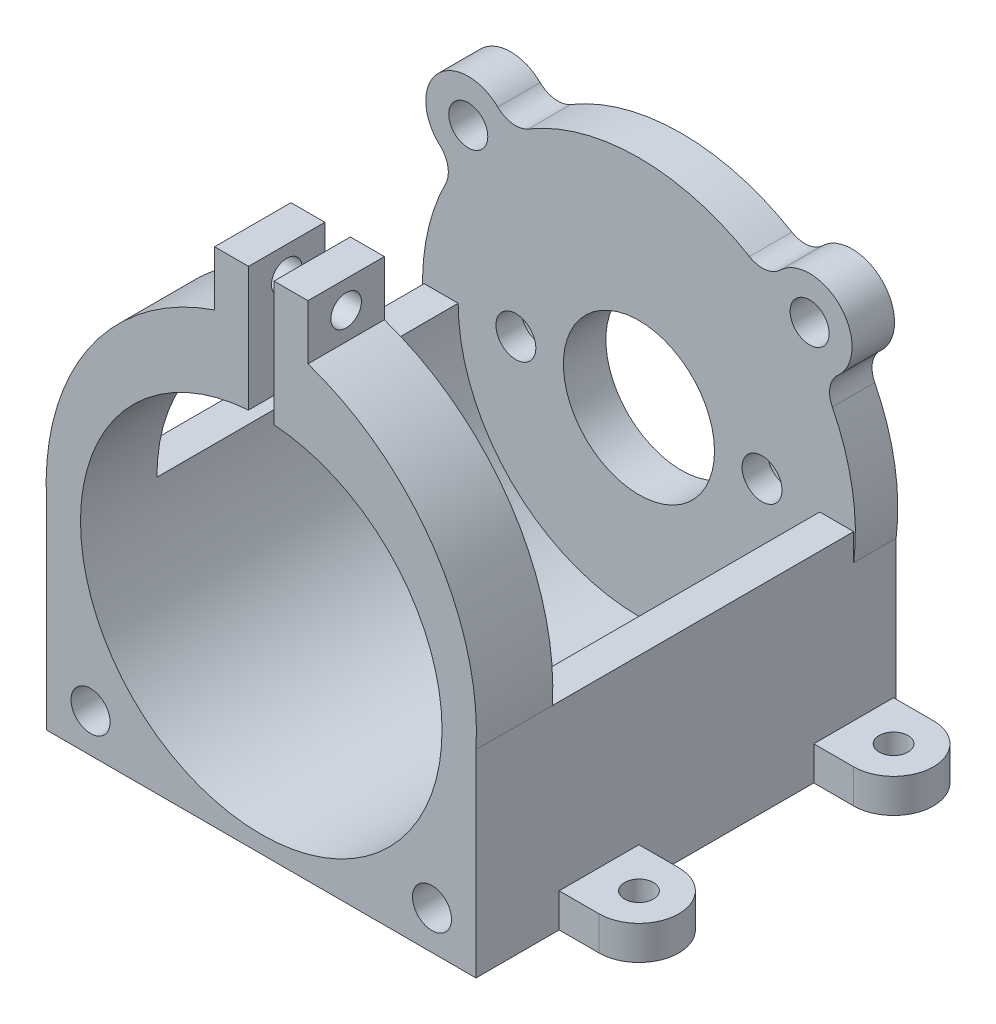
from build123d import *
from build123d.topology import SkipClean

# Parameters (mm, degrees)
SKETCH_1_R               = 2.35
SKETCH_1_R_2             = 8.9
EXTRUDE_1_DEPTH          = 5
EXTRUDE_2_DEPTH          = 44.5
EXTRUDE_2_DEPTH_BACK     = 5
EXTRUDE_START            = -9
EXTRUDE_3_DEPTH          = 9
SKETCH_5_R               = 1.8
CUT_EXTRUDE_2_DEPTH      = 19
CUT_EXTRUDE_5_DEPTH      = 10
CUT_EXTRUDE_5_DEPTH_BACK = 10
SKETCH_9_W               = 118.709111843
SKETCH_9_H               = 68.105929764
SKETCH_9_W_2             = 50.6
SKETCH_9_H_2             = 49.5
SKETCH_10_W              = 50.6
SKETCH_10_H              = 4.95
CUT_EXTRUDE_6_DEPTH      = 67.26064134
SKETCH_11_R              = 2.3
CUT_EXTRUDE_7_DEPTH      = 67.26064134
SKETCH_12_R              = 2.3
CUT_EXTRUDE_8_DEPTH      = 10
SKETCH_13_R              = 4.5
CUT_EXTRUDE_9_DEPTH      = 2
SKETCH_14_R              = 1.7
EXTRUDE_4_DEPTH          = 4


with BuildPart() as part:
    # Эскиз1 → Бобышка-Вытянуть1 (new body)
    with BuildSketch(Plane.XY):
        with BuildLine():
            ThreePointArc((-13.019103812, -21.9260789), (-14.899244328, -21.525926197), (-16.636311976, -22.349119084))
            ThreePointArc((-16.636311976, -22.349119084), (-23.768995303, -22.164946702), (-23.455168213, -15.036791017))
            ThreePointArc((-23.455168213, -15.036791017), (-22.512808868, -13.361377812), (-22.780834847, -11.457903983))
            ThreePointArc((-22.780834847, -11.457903983), (-25.5, 0), (-22.780834847, 11.457903983))
            ThreePointArc((-22.780834847, 11.457903983), (-22.512808868, 13.361377812), (-23.455168213, 15.036791017))
            ThreePointArc((-23.455168213, 15.036791017), (-23.768995303, 22.164946702), (-16.636311976, 22.349119084))
            ThreePointArc((-16.636311976, 22.349119084), (-14.899244328, 21.525926197), (-13.019103812, 21.9260789))
            ThreePointArc((-13.019103812, 21.9260789), (0, 25.5), (13.019103812, 21.9260789))
            ThreePointArc((13.019103812, 21.9260789), (14.899244328, 21.525926197), (16.636311976, 22.349119084))
            ThreePointArc((16.636311976, 22.349119084), (23.768995303, 22.164946702), (23.455168213, 15.036791017))
            ThreePointArc((23.455168213, 15.036791017), (22.512808868, 13.361377812), (22.780834847, 11.457903983))
            ThreePointArc((22.780834847, 11.457903983), (25.5, 0), (22.780834847, -11.457903983))
            ThreePointArc((22.780834847, -11.457903983), (22.512808868, -13.361377812), (23.455168213, -15.036791017))
            ThreePointArc((23.455168213, -15.036791017), (23.768995303, -22.164946702), (16.636311976, -22.349119084))
            ThreePointArc((16.636311976, -22.349119084), (14.899244328, -21.525926197), (13.019103812, -21.9260789))
            ThreePointArc((13.019103812, -21.9260789), (0, -25.5), (-13.019103812, -21.9260789))
        make_face()
        with Locations((-14.5, 0)):
            Circle(SKETCH_1_R, mode=Mode.SUBTRACT)
        with Locations((14.5, 0)):
            Circle(SKETCH_1_R, mode=Mode.SUBTRACT)
        Circle(SKETCH_1_R_2, mode=Mode.SUBTRACT)
    extrude(amount=EXTRUDE_1_DEPTH)

    # Эскиз2 → Бобышка-Вытянуть2 (add, two sides: drawn at the far end of the back side and taken through both)
    with BuildSketch(Plane.XY.offset(5).offset(-EXTRUDE_2_DEPTH_BACK)):
        with BuildLine():
            Line((-25.3, 0), (-21.3, 0))
            ThreePointArc((-21.3, 0), (0, -21.3), (21.3, 0))
            Line((21.3, 0), (25.3, 0))
            Line((25.3, 0), (25.3, -13.25))
            ThreePointArc((25.3, -13.25), (28.228932188, -20.321067812), (35.3, -23.25))
            Line((35.3, -23.25), (50, -23.25))
            Line((50, -23.25), (50, -28.25))
            Line((50, -28.25), (-50, -28.25))
            Line((-50, -28.25), (-50, -23.25))
            Line((-50, -23.25), (-35.3, -23.25))
            ThreePointArc((-35.3, -23.25), (-28.228932188, -20.321067812), (-25.3, -13.25))
            Line((-25.3, -13.25), (-25.3, 0))
        make_face()
    extrude(amount=EXTRUDE_2_DEPTH + EXTRUDE_2_DEPTH_BACK)

    # Эскиз4 → Бобышка-Вытянуть3 (add)
    with SkipClean():  # the faces are left unmerged after this step: merging them gives an invalid solid
        with BuildSketch(Plane.XY.offset(49.5).offset(EXTRUDE_START)):
            with BuildLine():
                Line((21.3, 0), (25.3, 0))
                ThreePointArc((25.3, 0), (20.373090978, 18.07450089), (5.5, 29.465426213))
                Line((5.5, 29.465426213), (5.5, 35.916188423))
                Line((5.5, 35.916188423), (1.5, 35.916188423))
                Line((1.5, 35.916188423), (1.5, 29.916188423))
                Line((1.5, 29.916188423), (1.5, 21.247117452))
                ThreePointArc((1.5, 21.247117452), (15.582682696, 14.521363572), (21.3, 0))
            make_face()
            with BuildLine():
                Line((-25.3, 0), (-21.3, 0))
                ThreePointArc((-21.3, 0), (-15.582682696, 14.521363572), (-1.5, 21.247117452))
                Line((-1.5, 21.247117452), (-1.5, 29.916188423))
                Line((-1.5, 29.916188423), (-1.5, 35.916188423))
                Line((-1.5, 35.916188423), (-5.5, 35.916188423))
                Line((-5.5, 35.916188423), (-5.5, 29.465426213))
                ThreePointArc((-5.5, 29.465426213), (-20.373090978, 18.07450089), (-25.3, 0))
            make_face()
        extrude(amount=EXTRUDE_3_DEPTH)

    # Эскиз5 → Вырез-Вытянуть2 (cut)
    with SkipClean():  # the faces are left unmerged after this step: merging them gives an invalid solid
        with BuildSketch(Plane.ZY.offset(5.5)):
            with Locations((45, 32.690807318)):
                Circle(SKETCH_5_R)
        extrude(amount=-CUT_EXTRUDE_2_DEPTH, mode=Mode.SUBTRACT)

    # Эскиз9 → Вырез-Вытянуть5 (cut, two sides: drawn at the far end of the back side and taken through both)
    with SkipClean():  # the faces are left unmerged after this step: merging them gives an invalid solid
        with BuildSketch(Plane(origin=(0, -23.25, 0), x_dir=(1, 0, 0), z_dir=(0, 1, 0)).offset(-CUT_EXTRUDE_5_DEPTH_BACK)):
            with Locations((-0.535798399, -23.678403203)):
                Rectangle(SKETCH_9_W, SKETCH_9_H)
            with Locations((0, -24.75)):
                Rectangle(SKETCH_9_W_2, SKETCH_9_H_2, mode=Mode.SUBTRACT)
        extrude(amount=CUT_EXTRUDE_5_DEPTH + CUT_EXTRUDE_5_DEPTH_BACK, mode=Mode.SUBTRACT)

    # Эскиз10 → Вырез-Вытянуть6 (cut, through all)
    with SkipClean():  # the faces are left unmerged after this step: merging them gives an invalid solid
        with BuildSketch(Plane.XY.offset(49.5)):
            with Locations((0, -25.775)):
                Rectangle(SKETCH_10_W, SKETCH_10_H)
        extrude(amount=-CUT_EXTRUDE_6_DEPTH, mode=Mode.SUBTRACT)

    # Эскиз11 → Вырез-Вытянуть7 (cut, through all)
    with SkipClean():  # the faces are left unmerged after this step: merging them gives an invalid solid
        with BuildSketch(Plane(origin=(0, 0, 0), x_dir=(-1, 0, 0), z_dir=(0, 0, -1))):
            with Locations((-20.112226795, -18.754954902)):
                Circle(SKETCH_11_R)
            with Locations((20.112226795, -18.754954902)):
                Circle(SKETCH_11_R)
        extrude(amount=-CUT_EXTRUDE_7_DEPTH, mode=Mode.SUBTRACT)

    # Эскиз12 → Вырез-Вытянуть8 (cut)
    with SkipClean():  # the faces are left unmerged after this step: merging them gives an invalid solid
        with BuildSketch(Plane(origin=(0, 0, 0), x_dir=(-1, 0, 0), z_dir=(0, 0, -1))):
            with Locations((-20.112226795, 18.754954902)):
                Circle(SKETCH_12_R)
            with Locations((20.112226795, 18.754954902)):
                Circle(SKETCH_12_R)
        extrude(amount=-CUT_EXTRUDE_8_DEPTH, mode=Mode.SUBTRACT)

    # Эскиз13 → Вырез-Вытянуть9 (cut)
    with SkipClean():  # the faces are left unmerged after this step: merging them gives an invalid solid
        with BuildSketch(Plane(origin=(0, 0, 0), x_dir=(-1, 0, 0), z_dir=(0, 0, -1))):
            with Locations((-14.5, 0)):
                Circle(SKETCH_13_R)
            with Locations((14.5, 0)):
                Circle(SKETCH_13_R)
        extrude(amount=-CUT_EXTRUDE_9_DEPTH, mode=Mode.SUBTRACT)

    # Эскиз14 → Бобышка-Вытянуть4 (add)
    # profile 1 of 4: a face of its own
    with SkipClean():  # the faces are left unmerged after this step: merging them gives an invalid solid
        with BuildSketch(Plane.XZ.offset(23.3)):
            with BuildLine():
                Line((-30, 39.7), (-25.3, 39.7))
                Line((-25.3, 39.7), (-25.3, 30.3))
                Line((-25.3, 30.3), (-30, 30.3))
                ThreePointArc((-30, 30.3), (-34.7, 35), (-30, 39.7))
            make_face()
            with Locations((-30, 35)):
                Circle(SKETCH_14_R, mode=Mode.SUBTRACT)
        # profile 2 of 4: a face of its own
        with BuildSketch(Plane.XZ.offset(23.3)):
            with BuildLine():
                Line((25.3, 39.7), (25.3, 30.3))
                Line((25.3, 30.3), (30, 30.3))
                ThreePointArc((30, 30.3), (34.7, 35), (30, 39.7))
                Line((30, 39.7), (25.3, 39.7))
            make_face()
            with Locations((30, 35)):
                Circle(SKETCH_14_R, mode=Mode.SUBTRACT)
        # profile 3 of 4: a face of its own
        with BuildSketch(Plane.XZ.offset(23.3)):
            with BuildLine():
                Line((30, 0.3), (25.3, 0.3))
                Line((25.3, 0.3), (25.3, 9.7))
                Line((25.3, 9.7), (30, 9.7))
                ThreePointArc((30, 9.7), (34.7, 5), (30, 0.3))
            make_face()
            with Locations((30, 5)):
                Circle(SKETCH_14_R, mode=Mode.SUBTRACT)
        # profile 4 of 4: a face of its own
        with BuildSketch(Plane.XZ.offset(23.3)):
            with BuildLine():
                Line((-25.3, 0.3), (-25.3, 9.7))
                Line((-25.3, 9.7), (-30, 9.7))
                ThreePointArc((-30, 9.7), (-34.7, 5), (-30, 0.3))
                Line((-30, 0.3), (-25.3, 0.3))
            make_face()
            with Locations((-30, 5)):
                Circle(SKETCH_14_R, mode=Mode.SUBTRACT)
        extrude(amount=-EXTRUDE_4_DEPTH)


solid = part.part
